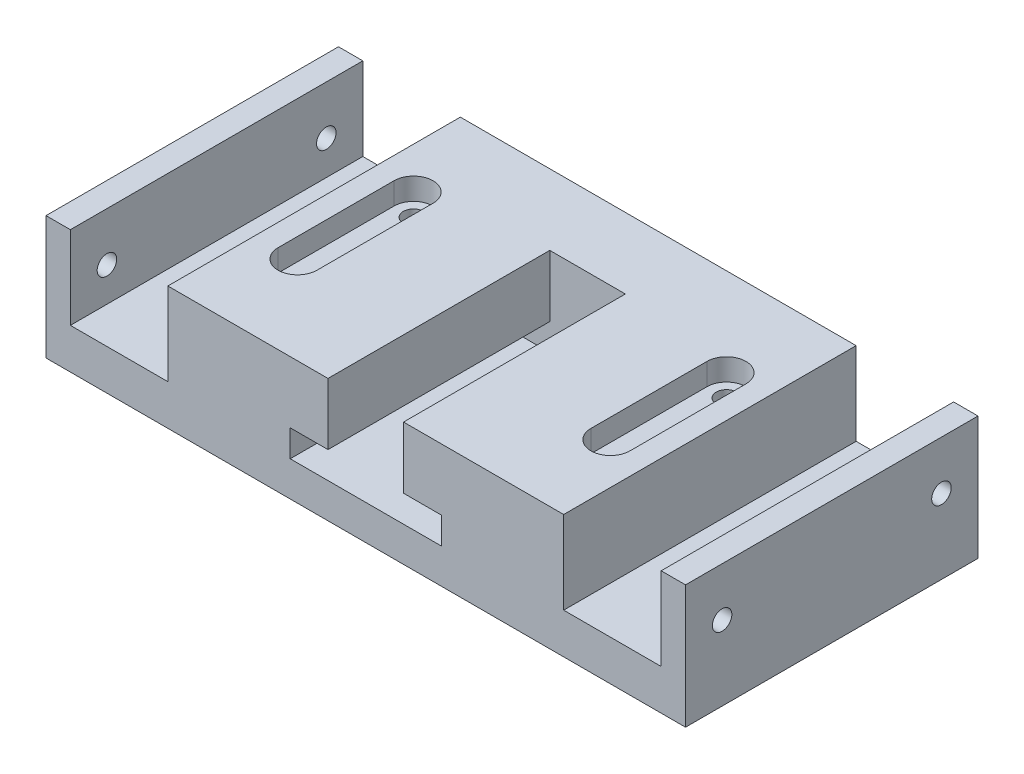
from build123d import *

# Parameters (mm, degrees)
SKETCH_1_W          = 131.2
SKETCH_1_H          = 25.3
EXTRUDE_1_DEPTH     = 60
CUT_EXTRUDE_1_DEPTH = 45.5
SKETCH_5_R          = 2.1
CUT_EXTRUDE_2_DEPTH = 45.5
CUT_EXTRUDE_3_DEPTH = 4.5
SKETCH_7_W          = 20
SKETCH_7_H          = 17
CUT_EXTRUDE_4_DEPTH = 90.796339012
CUT_EXTRUDE_5_REACH = 146.822
SKETCH_8_R          = 2
CUT_EXTRUDE_6_REACH = 146.822
SKETCH_9_R          = 2
SKETCH_10_R         = 3.5
CUT_EXTRUDE_7_DEPTH = 4


with BuildPart() as part:
    # 草圖1 → 填料-伸長1 (new body)
    with BuildSketch(Plane.XY):
        Rectangle(SKETCH_1_W, SKETCH_1_H)
    extrude(amount=EXTRUDE_1_DEPTH)

    # 草圖4 → 除料-伸長1 (cut)
    with BuildSketch(Plane.XY.offset(60)):
        Polygon((7.75, 12.65), (-7.75, 12.65), (-7.75, 0), (-15.5, 0), (-15.5, -5.5), (15.5, -5.5), (15.5, 0), (7.75, 0), align=None)
    extrude(amount=-CUT_EXTRUDE_1_DEPTH, mode=Mode.SUBTRACT)

    # 草圖5 → 除料-伸長2 (cut)
    with BuildSketch(Plane(origin=(0, 12.65, 0), x_dir=(1, 0, 0), z_dir=(0, 1, 0))):
        with Locations((-32.1, -18.1)):
            Circle(SKETCH_5_R)
        with Locations((32.1, -18.1)):
            Circle(SKETCH_5_R)
        with Locations((-32.1, -41.9)):
            Circle(SKETCH_5_R)
        with Locations((32.1, -41.9)):
            Circle(SKETCH_5_R)
    extrude(amount=-CUT_EXTRUDE_2_DEPTH, mode=Mode.SUBTRACT)

    # 草圖6 → 除料-伸長3 (cut)
    with BuildSketch(Plane(origin=(0, 12.65, 0), x_dir=(1, 0, 0), z_dir=(0, 1, 0))):
        with BuildLine():
            Line((-28.1, -41.9), (-28.1, -18.1))
            ThreePointArc((-28.1, -18.1), (-32.1, -14.1), (-36.1, -18.1))
            Line((-36.1, -18.1), (-36.1, -41.9))
            ThreePointArc((-36.1, -41.9), (-32.1, -45.9), (-28.1, -41.9))
        make_face()
        with BuildLine():
            Line((36.1, -18.1), (36.1, -41.9))
            ThreePointArc((36.1, -41.9), (32.1, -45.9), (28.1, -41.9))
            Line((28.1, -41.9), (28.1, -18.1))
            ThreePointArc((28.1, -18.1), (32.1, -14.1), (36.1, -18.1))
        make_face()
    extrude(amount=-CUT_EXTRUDE_3_DEPTH, mode=Mode.SUBTRACT)

    # 草圖7 → 除料-伸長4 (cut, through all)
    with BuildSketch(Plane.XY.offset(60)):
        with Locations((-50.6, 4.15)):
            Rectangle(SKETCH_7_W, SKETCH_7_H)
        with Locations((50.6, 4.15)):
            Rectangle(SKETCH_7_W, SKETCH_7_H)
    extrude(amount=-CUT_EXTRUDE_4_DEPTH, mode=Mode.SUBTRACT)

    # 草圖8 → 除料-伸長5 (cut, up to next)
    with BuildSketch(Plane.ZY.offset(65.6), mode=Mode.PRIVATE) as cut_extrude_5_sk1:
        with Locations((52.5, 2.65)):
            Circle(SKETCH_8_R)
    cut_extrude_5_tool1 = extrude(cut_extrude_5_sk1.sketch, amount=-CUT_EXTRUDE_5_REACH, mode=Mode.PRIVATE) & part.part
    # 草圖8 → 除料-伸長5 (cut, up to next)
    with BuildSketch(Plane.ZY.offset(65.6), mode=Mode.PRIVATE) as cut_extrude_5_sk2:
        with Locations((7.5, 2.65)):
            Circle(SKETCH_8_R)
    cut_extrude_5_tool2 = extrude(cut_extrude_5_sk2.sketch, amount=-CUT_EXTRUDE_5_REACH, mode=Mode.PRIVATE) & part.part
    add(cut_extrude_5_tool1.solids().sort_by_distance((-65.6, 2.65, 52.5))[0], mode=Mode.SUBTRACT)
    add(cut_extrude_5_tool2.solids().sort_by_distance((-65.6, 2.65, 7.5))[0], mode=Mode.SUBTRACT)

    # 草圖9 → 除料-伸長6 (cut, up to next)
    with BuildSketch(Plane(origin=(65.6, 0, 0), x_dir=(0, 0, -1), z_dir=(1, 0, 0)), mode=Mode.PRIVATE) as cut_extrude_6_sk1:
        with Locations((-7.5, 2.65)):
            Circle(SKETCH_9_R)
    cut_extrude_6_tool1 = extrude(cut_extrude_6_sk1.sketch, amount=-CUT_EXTRUDE_6_REACH, mode=Mode.PRIVATE) & part.part
    # 草圖9 → 除料-伸長6 (cut, up to next)
    with BuildSketch(Plane(origin=(65.6, 0, 0), x_dir=(0, 0, -1), z_dir=(1, 0, 0)), mode=Mode.PRIVATE) as cut_extrude_6_sk2:
        with Locations((-52.5, 2.65)):
            Circle(SKETCH_9_R)
    cut_extrude_6_tool2 = extrude(cut_extrude_6_sk2.sketch, amount=-CUT_EXTRUDE_6_REACH, mode=Mode.PRIVATE) & part.part
    add(cut_extrude_6_tool1.solids().sort_by_distance((65.6, 2.65, 7.5))[0], mode=Mode.SUBTRACT)
    add(cut_extrude_6_tool2.solids().sort_by_distance((65.6, 2.65, 52.5))[0], mode=Mode.SUBTRACT)

    # 草圖10 → 除料-伸長7 (cut)
    with BuildSketch(Plane.XZ.offset(12.65)):
        with Locations((-32.1, 10.6)):
            Circle(SKETCH_10_R)
        with Locations((32.1, 10.6)):
            Circle(SKETCH_10_R)
        with Locations((32.1, 49.4)):
            Circle(SKETCH_10_R)
        with Locations((-32.1, 47.9)):
            Circle(SKETCH_10_R)
    extrude(amount=-CUT_EXTRUDE_7_DEPTH, mode=Mode.SUBTRACT)


solid = part.part
